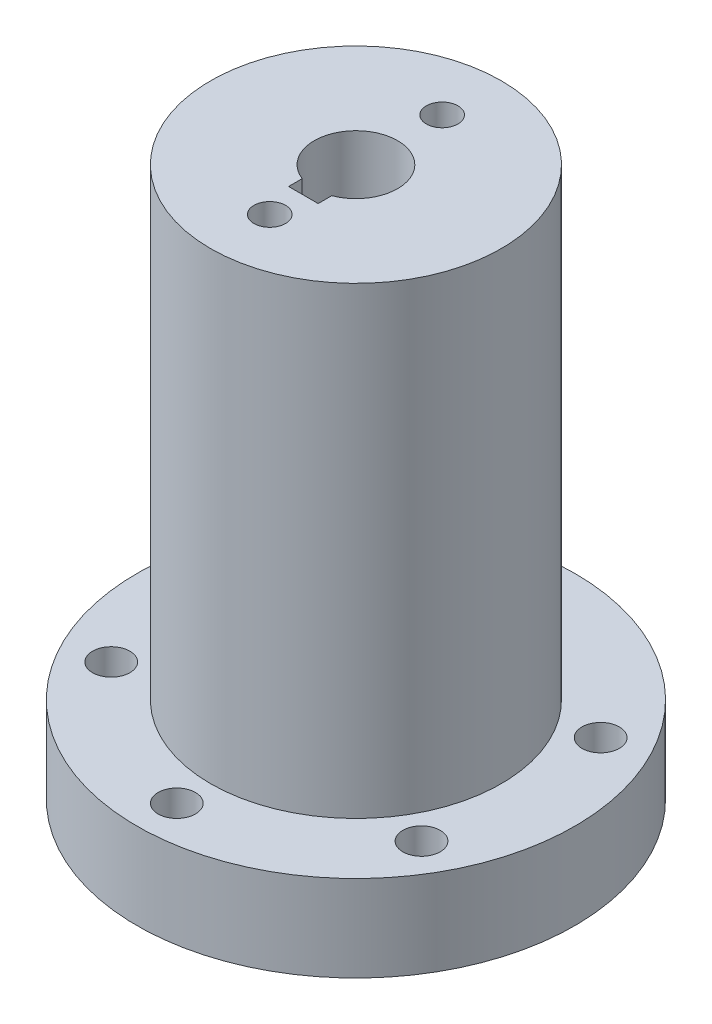
from build123d import *

# Parameters (mm, degrees)
SKETCH1_R           = 25.3
BOSS_EXTRUDE1_DEPTH = 8.5
SKETCH2_R           = 25.3
BOSS_EXTRUDE2_DEPTH = 57.15
SKETCH7_R           = 25.3
BOSS_EXTRUDE4_DEPTH = 15
CUT_EXTRUDE3_DEPTH  = 115
SKETCH6_R           = 38.1
BOSS_EXTRUDE3_DEPTH = 15
SKETCH9_R           = 3.25
CUT_EXTRUDE4_DEPTH  = 20
SKETCH10_R          = 2.75
CUT_EXTRUDE6_DEPTH  = 129
BOSS_EXTRUDE5_START = -93
BOSS_EXTRUDE5_DEPTH = 93
CUT_EXTRUDE7_DEPTH  = 40


with BuildPart() as part:
    # Sketch1 → Boss-Extrude1 (new body)
    with BuildSketch(Plane(origin=(0, 0, 0), x_dir=(1, 0, 0), z_dir=(0, 1, 0))):
        Circle(SKETCH1_R)
    extrude(amount=BOSS_EXTRUDE1_DEPTH)

    # Sketch2 → Boss-Extrude2 (add)
    with BuildSketch(Plane(origin=(0, 8.5, 0), x_dir=(1, 0, 0), z_dir=(0, 1, 0))):
        Circle(SKETCH2_R)
    extrude(amount=BOSS_EXTRUDE2_DEPTH)

    # Sketch7 → Boss-Extrude4 (add)
    with BuildSketch(Plane(origin=(0, 65.65, 0), x_dir=(1, 0, 0), z_dir=(0, 1, 0))):
        Circle(SKETCH7_R)
    extrude(amount=BOSS_EXTRUDE4_DEPTH)

    # Sketch5 → Cut-Extrude3 (cut)
    with BuildSketch(Plane.XZ):
        with BuildLine():
            Line((2.575, 9.15), (-2.575, 9.15))
            Line((-2.575, 9.15), (-2.575, 6.777305881))
            ThreePointArc((-2.575, 6.777305881), (0, -7.25), (2.575, 6.777305881))
            Line((2.575, 6.777305881), (2.575, 9.15))
        make_face()
    extrude(amount=-CUT_EXTRUDE3_DEPTH, mode=Mode.SUBTRACT)

    # Sketch6 → Boss-Extrude3 (add)
    with BuildSketch(Plane.XZ):
        Circle(SKETCH6_R)
    extrude(amount=BOSS_EXTRUDE3_DEPTH)

    # Sketch9 → Cut-Extrude4 (cut)
    with BuildSketch(Plane(origin=(0, 0, 0), x_dir=(1, 0, 0), z_dir=(0, 1, 0))):
        with Locations((0, 31.176914536)):
            Circle(SKETCH9_R)
        with Locations((-27, 15.588457268)):
            Circle(SKETCH9_R)
        with Locations((27, 15.588457268)):
            Circle(SKETCH9_R)
        with Locations((-27, -15.588457268)):
            Circle(SKETCH9_R)
        with Locations((27, -15.588457268)):
            Circle(SKETCH9_R)
        with Locations((0, -31.176914536)):
            Circle(SKETCH9_R)
    extrude(amount=-CUT_EXTRUDE4_DEPTH, mode=Mode.SUBTRACT)

    # Sketch10 → Cut-Extrude6 (cut)
    with BuildSketch(Plane(origin=(0, 80.65, 0), x_dir=(1, 0, 0), z_dir=(0, 1, 0))):
        with Locations((0, 15)):
            Circle(SKETCH10_R)
        with Locations((0, -15)):
            Circle(SKETCH10_R)
    extrude(amount=-CUT_EXTRUDE6_DEPTH, mode=Mode.SUBTRACT)

    # Sketch11 → Boss-Extrude5 (add)
    with BuildSketch(Plane(origin=(0, 80.65, 0), x_dir=(1, 0, 0), z_dir=(0, 1, 0)).offset(BOSS_EXTRUDE5_START)):
        with BuildLine():
            Line((2.575, -9.15), (2.575, -6.777305881))
            ThreePointArc((2.575, -6.777305881), (0, 7.25), (-2.575, -6.777305881))
            Line((-2.575, -6.777305881), (-2.575, -9.15))
            Line((-2.575, -9.15), (2.575, -9.15))
        make_face()
    extrude(amount=BOSS_EXTRUDE5_DEPTH)

    # Sketch11<3> → Cut-Extrude7 (cut)
    with BuildSketch(Plane(origin=(0, 80.65, 0), x_dir=(1, 0, 0), z_dir=(0, 1, 0))):
        with BuildLine():
            Line((2.575, -9.15), (2.575, -6.777305881))
            ThreePointArc((2.575, -6.777305881), (0, 7.25), (-2.575, -6.777305881))
            Line((-2.575, -6.777305881), (-2.575, -9.15))
            Line((-2.575, -9.15), (2.575, -9.15))
        make_face()
    extrude(amount=-CUT_EXTRUDE7_DEPTH, mode=Mode.SUBTRACT)


solid = part.part
